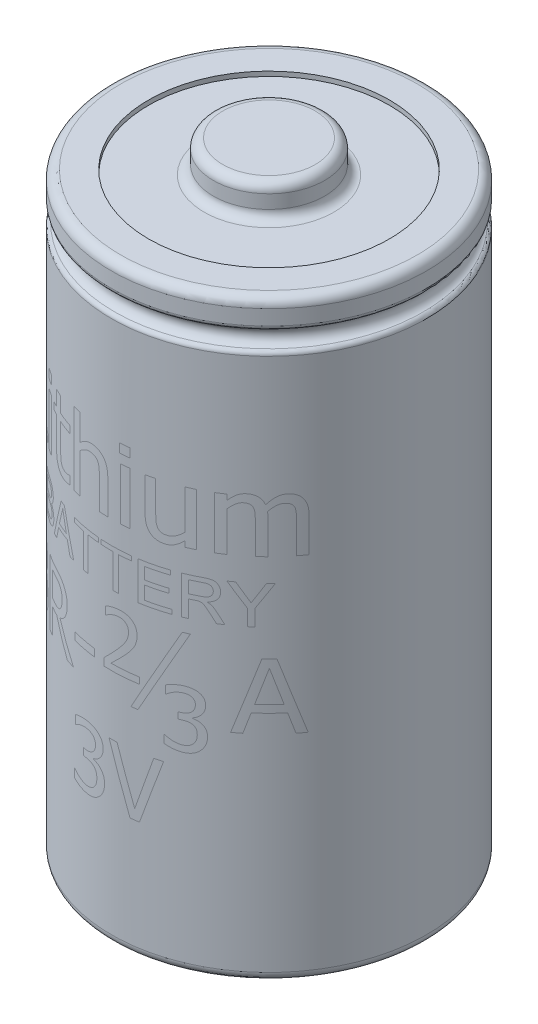
from build123d import *


with BuildPart() as part:
    # Sketch1 → Revolve1 (revolve)
    with BuildSketch(Plane.XY):
        with BuildLine():
            Line((8.5, 30.707106781), (8.5, 31.52))
            ThreePointArc((8.5, 31.52), (8.353553391, 31.873553391), (8, 32.02))
            Line((8, 32.02), (6.5, 32.02))
            Line((6.5, 32.02), (6.5, 31.77))
            Line((6.5, 31.77), (3.5, 31.77))
            ThreePointArc((3.5, 31.77), (3.146446609, 31.916446609), (3, 32.27))
            Line((3, 32.27), (3, 33))
            ThreePointArc((3, 33), (2.853553391, 33.353553391), (2.5, 33.5))
            Line((2.5, 33.5), (0, 33.5))
            Line((0, 33.5), (0, 0.25))
            Line((0, 0.25), (6.5, 0.25))
            Line((6.5, 0.25), (6.5, 0))
            Line((6.5, 0), (8, 0))
            ThreePointArc((8, 0), (8.353553391, 0.146446609), (8.5, 0.5))
            Line((8.5, 0.5), (8.5, 29.292893219))
            ThreePointArc((8.5, 29.292893219), (8.454124145, 29.437230786), (8.333333333, 29.528595479))
            ThreePointArc((8.333333333, 29.528595479), (8, 30), (8.333333333, 30.471404521))
            ThreePointArc((8.333333333, 30.471404521), (8.454124145, 30.562769214), (8.5, 30.707106781))
        make_face()
    revolve(axis=Axis((0, -4.08264352, 0), (0, 1, 0)))


solid = part.part
